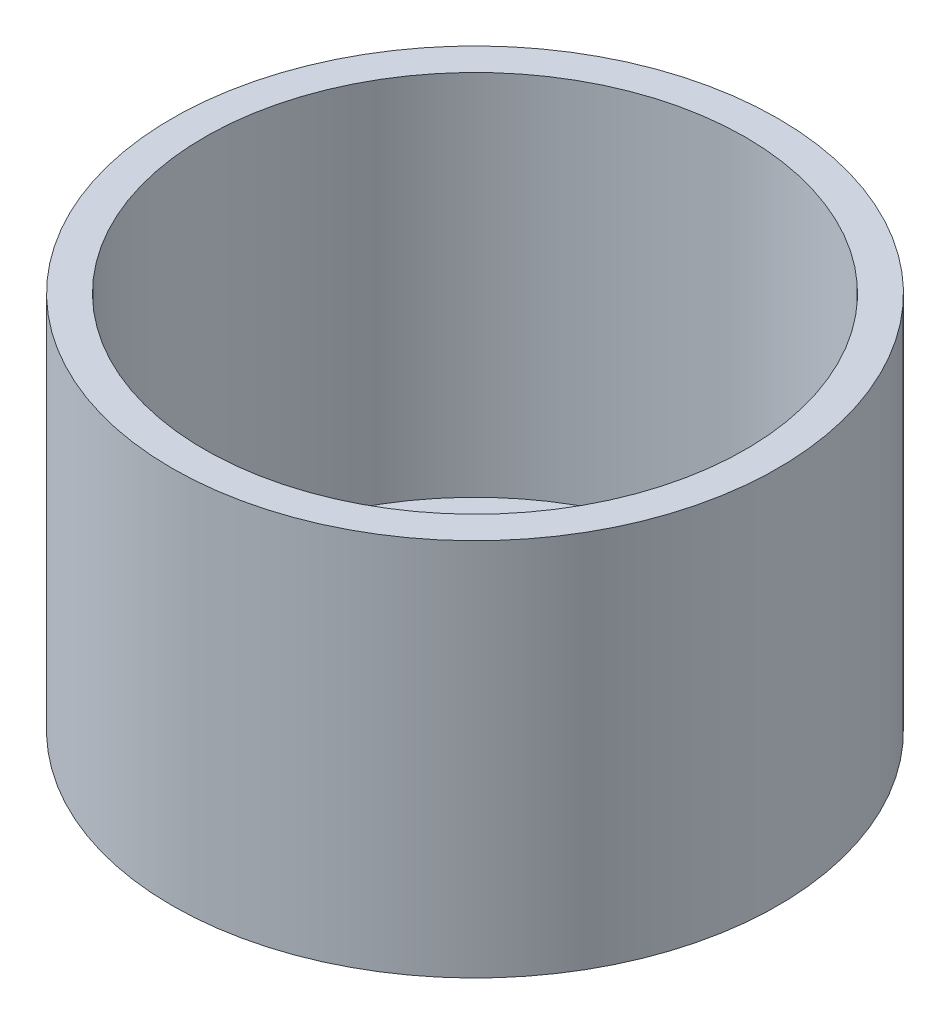
from build123d import *

# Parameters (mm, degrees)
SKETCH1_W           = 250
SKETCH1_H           = 250
BOSS_EXTRUDE1_DEPTH = 5
SKETCH8_R           = 7.5
BOSS_EXTRUDE3_DEPTH = 5
FILLET6_R           = 2
FILLET7_R           = 0.5
SKETCH11_R          = 2.5
CUT_EXTRUDE4_DEPTH  = 10
SKETCH12_OUTSIDE_W  = 322.738
SKETCH12_OUTSIDE_H  = 322.738
SKETCH12_OUTSIDE_R  = 125
CUT_EXTRUDE5_DEPTH  = 10
SKETCH13_R          = 140
SKETCH13_R_2        = 125
BOSS_EXTRUDE4_DEPTH = 175


with BuildPart() as part:
    # Sketch1 → Boss-Extrude1 (new body)
    with BuildSketch(Plane(origin=(0, 0, 0), x_dir=(1, 0, 0), z_dir=(0, 1, 0))):
        Rectangle(SKETCH1_W, SKETCH1_H)
    extrude(amount=BOSS_EXTRUDE1_DEPTH)

    # Sketch8 → Boss-Extrude3 (add)
    with BuildSketch(Plane(origin=(0, 5, 0), x_dir=(1, 0, 0), z_dir=(0, 1, 0))):
        with Locations((99.778960279, -1.147118049)):
            Circle(SKETCH8_R)
        with Locations((0, -95)):
            Circle(SKETCH8_R)
    extrude(amount=BOSS_EXTRUDE3_DEPTH)

    # Sketch9 → Cut-Revolve3 (revolve, cut)
    with BuildSketch(Plane(origin=(0, 0, 0), x_dir=(0, 0, -1), z_dir=(1, 0, 0))):
        with BuildLine():
            Line((-95, 15), (-95, 5))
            ThreePointArc((-95, 5), (-100, 10), (-95, 15))
        make_face()
    revolve(axis=Axis((0, 10, 95), (0, -1, 0)), mode=Mode.SUBTRACT)

    # Sketch10 → Cut-Revolve4 (revolve, cut)
    with BuildSketch(Plane.XY.offset(1.05)):
        with BuildLine():
            Line((99.778960279, 15), (99.778960279, 5))
            ThreePointArc((99.778960279, 5), (94.778960279, 10), (99.778960279, 15))
        make_face()
    revolve(axis=Axis((99.778960279, 15, 1.05), (0, -1, 0)), mode=Mode.SUBTRACT)

    # Fillet6
    fillet6_edges = [part.edges().sort_by_distance(p)[0] for p in [
        (92.278960279, 5, 1.147118049),
        (-7.5, 5, 95),
    ]]
    fillet(fillet6_edges, radius=FILLET6_R)

    # Fillet7
    fillet7_edges = [part.edges().sort_by_distance(p)[0] for p in [
        (92.278960279, 10, 1.147118049),
        (-7.5, 10, 95),
    ]]
    fillet(fillet7_edges, radius=FILLET7_R)

    # Sketch11 → Cut-Extrude4 (cut)
    with BuildSketch(Plane(origin=(0, 5, 0), x_dir=(1, 0, 0), z_dir=(0, 1, 0))):
        with Locations((-47.523004126, 40.208103233)):
            Circle(SKETCH11_R)
        with Locations((-19.240698593, 30.202545091)):
            Circle(SKETCH11_R)
        with Locations((-9.235140451, 58.484850625)):
            Circle(SKETCH11_R)
        with Locations((-37.517445985, 68.490408766)):
            Circle(SKETCH11_R)
    extrude(amount=-CUT_EXTRUDE4_DEPTH, mode=Mode.SUBTRACT)

    # Sketch12 outside → Cut-Extrude5 (cut)
    with BuildSketch(Plane(origin=(0, 0, 0), x_dir=(-1, 0, 0), z_dir=(0, -1, 0))):
        Rectangle(SKETCH12_OUTSIDE_W, SKETCH12_OUTSIDE_H)
        Circle(SKETCH12_OUTSIDE_R, mode=Mode.SUBTRACT)
    extrude(amount=-CUT_EXTRUDE5_DEPTH, mode=Mode.SUBTRACT)

    # Sketch13 → Boss-Extrude4 (add)
    with BuildSketch(Plane.XZ):
        Circle(SKETCH13_R)
        Circle(SKETCH13_R_2, mode=Mode.SUBTRACT)
    extrude(amount=-BOSS_EXTRUDE4_DEPTH)


solid = part.part
